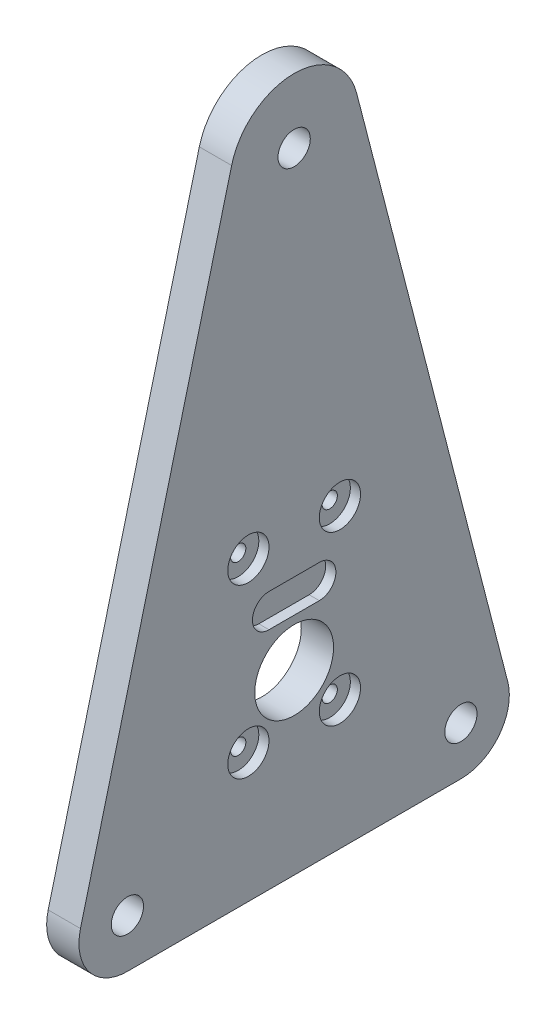
from build123d import *

# Parameters (mm, degrees)
SKETCH1_R                             = 3.175
SKETCH1_R_2                           = 7.749999994
BOSS_EXTRUDE1_DEPTH                   = 6.35
CSK_FOR_M3_FLAT_HEAD_MACHINE_SCREW1_D = 3
SKETCH4_R                             = 4.054
CUT_EXTRUDE1_DEPTH                    = 2


with BuildPart() as part:
    # Sketch1 → Boss-Extrude1 (new body)
    with BuildSketch(Plane(origin=(0, 0, 0), x_dir=(0, 0, -1), z_dir=(1, 0, 0))):
        with BuildLine():
            Line((-12.411873976, 117.475), (-33.931137693, 34.13125))
            Line((-33.931137693, 34.13125), (-42.128952443, 2.38125))
            ThreePointArc((-42.128952443, 2.38125), (-40.436584528, -5.83284745), (-32.90641085, -9.525))
            Line((-32.90641085, -9.525), (32.676107146, -9.525))
            ThreePointArc((32.676107146, -9.525), (40.206280824, -5.83284745), (41.898648739, 2.38125))
            Line((41.898648739, 2.38125), (33.70083399, 34.13125))
            Line((33.70083399, 34.13125), (12.181570272, 117.475))
            ThreePointArc((12.181570272, 117.475), (-0.115151852, 127), (-12.411873976, 117.475))
        make_face()
        with Locations((-0.115151852, 114.3)):
            Circle(SKETCH1_R, mode=Mode.SUBTRACT)
        with Locations((-0.115151852, 25.4)):
            Circle(SKETCH1_R_2, mode=Mode.SUBTRACT)
        with Locations((-32.90641085, 0)):
            Circle(SKETCH1_R, mode=Mode.SUBTRACT)
        with Locations((32.676107146, 0)):
            Circle(SKETCH1_R, mode=Mode.SUBTRACT)
    extrude(amount=BOSS_EXTRUDE1_DEPTH)

    # CSK for M3 Flat Head Machine Screw1 (through all)
    with Locations(Plane.ZY):
        with Locations((9.115151852, 15.860620525), (9.115151852, 48.860620525), (-8.884848148, 48.860620525), (-8.884848148, 15.860620525)):
            Hole(CSK_FOR_M3_FLAT_HEAD_MACHINE_SCREW1_D / 2)

    # Sketch4 → Cut-Extrude1 (cut)
    with BuildSketch(Plane(origin=(6.35, 0, 0), x_dir=(0, 0, -1), z_dir=(1, 0, 0))):
        with Locations((-9.115151852, 48.860620525)):
            Circle(SKETCH4_R)
        with Locations((8.884848148, 48.860620525)):
            Circle(SKETCH4_R)
        with Locations((-9.115151852, 15.860620525)):
            Circle(SKETCH4_R)
        with Locations((8.884848148, 15.860620525)):
            Circle(SKETCH4_R)
        with BuildLine():
            Line((-5.065151852, 41.254), (4.834848148, 41.254))
            ThreePointArc((4.834848148, 41.254), (8.088848148, 38), (4.834848148, 34.746))
            Line((4.834848148, 34.746), (-5.065151852, 34.746))
            ThreePointArc((-5.065151852, 34.746), (-8.319151852, 38), (-5.065151852, 41.254))
        make_face()
    extrude(amount=-CUT_EXTRUDE1_DEPTH, mode=Mode.SUBTRACT)


solid = part.part
